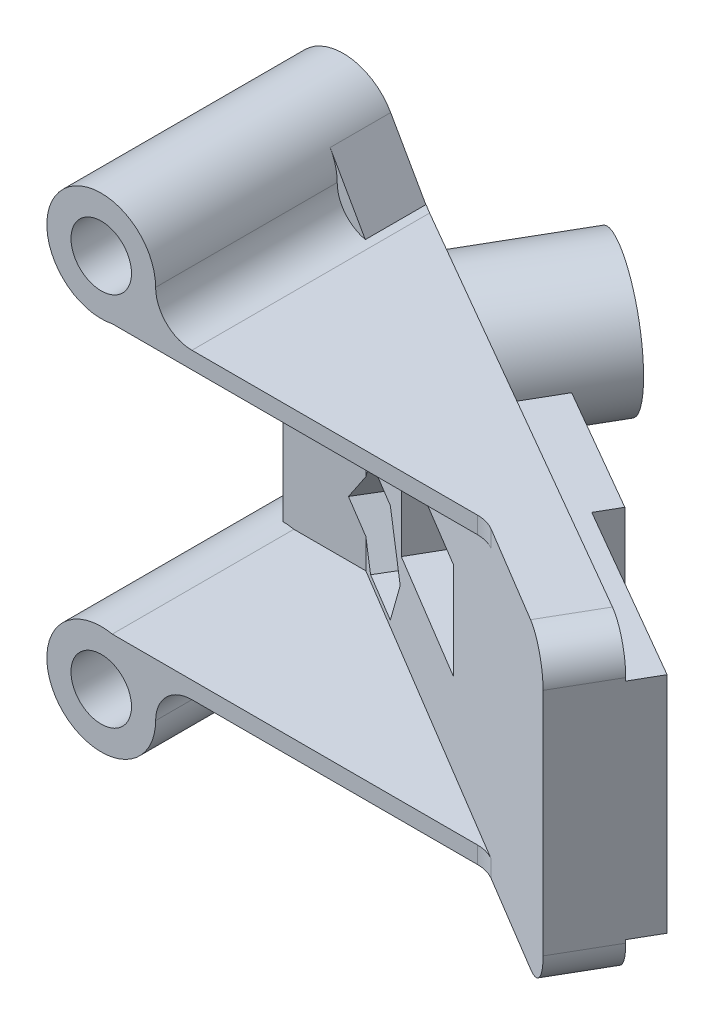
from build123d import *
from build123d.topology import SkipClean

# Parameters (mm, degrees)
CROQUIS3_R                 = 2.5
SALIENTE_EXTRUIR1_DEPTH    = 5
CROQUIS6_W                 = 27
CROQUIS6_H                 = 16.5
CORTAR_EXTRUIR1_DEPTH      = 2
CROQUIS7_W                 = 29
CROQUIS7_H                 = 18.5
CROQUIS7_W_2               = 27
CROQUIS7_H_2               = 16.5
SALIENTE_EXTRUIR2_DEPTH    = 2.5
CROQUIS8_W                 = 12
CROQUIS8_H                 = 18.5
SALIENTE_EXTRUIR3_DEPTH    = 2
CROQUIS9_W                 = 12.5
CROQUIS9_H                 = 8
CORTAR_EXTRUIR2_DEPTH      = 10
CROQUIS10_R                = 3.25
CORTAR_EXTRUIR3_DEPTH      = 10
CORTAR_EXTRUIR4_DEPTH      = 3
CORTAR_EXTRUIR4_DEPTH_BACK = 3
CROQUIS12_R                = 4.493807468
CROQUIS12_R_2              = 2.5
SALIENTE_EXTRUIR4_DEPTH    = 15
SALIENTE_EXTRUIR5_DEPTH    = 1.4
REDONDEO1_R                = 3
SALIENTE_EXTRUIR6_START    = 10
CROQUIS14_R                = 5.706356105
CROQUIS14_R_2              = 3.25
SALIENTE_EXTRUIR6_DEPTH    = 10
CORTAR_EXTRUIR5_DEPTH      = 10


with BuildPart() as part:
    # Croquis3 → Saliente-Extruir1 (new body)
    with BuildSketch(Plane.XY):
        with BuildLine():
            Line((-8.662935846, -3.067476434), (-11.613388129, -8.280831326))
            ThreePointArc((-11.613388129, -8.280831326), (-19.406371569, -8.331091381), (-15.524316735, -1.57366826))
            Line((-15.524316735, -1.57366826), (-15.524316735, 20.438715392))
            ThreePointArc((-15.524316735, 20.438715392), (-19.406371569, 27.196138513), (-11.613388129, 27.145878458))
            Line((-11.613388129, 27.145878458), (-8.662935846, 21.932523566))
            Line((-8.662935846, 21.932523566), (-8.662935846, -3.067476434))
        make_face()
        with Locations((-15.524316735, 24.93252286)):
            Circle(CROQUIS3_R, mode=Mode.SUBTRACT)
        with Locations((-15.524316735, -6.067475728)):
            Circle(CROQUIS3_R, mode=Mode.SUBTRACT)
    extrude(amount=SALIENTE_EXTRUIR1_DEPTH)

    # Croquis5 → section 0 of recubrir1
    with BuildSketch(Plane(origin=(32.473941286, 0, 18.748838743), x_dir=(0.5000000000000042, 0, -0.8660254037844363), z_dir=(0.8660254037844363, 0, 0.5000000000000042)), mode=Mode.PRIVATE) as recubrir1_s0:
        with BuildLine():
            Line((-4.331467923, 21.932523566), (-9.331467923, 21.932523566))
            Line((-9.331467923, 21.932523566), (-9.331467923, -3.067476434))
            Line((-9.331467923, -3.067476434), (-4.331467923, -3.067476434))
            Line((-4.331467923, -3.067476434), (-4.331467923, 21.932523566))
        make_face()
    # loft up to a face of the part (recubrir1)
    loft([recubrir1_s0.sketch, part.faces().sort_by_distance((-8.662935846, 9.432523566, 2.5))[0]])

    # Croquis6 → Cortar-Extruir1 (cut)
    with BuildSketch(Plane(origin=(-2.165733961, 0, 3.751161257), x_dir=(-0.8660254037844364, 0, -0.5000000000000041), z_dir=(0.500000000000004, 0, -0.8660254037844363))):
        with Locations((-22.997677486, 9.432523566)):
            Rectangle(CROQUIS6_W, CROQUIS6_H)
    extrude(amount=-CORTAR_EXTRUIR1_DEPTH, mode=Mode.SUBTRACT)

    # Croquis7 → Saliente-Extruir2 (add)
    with BuildSketch(Plane(origin=(-2.165733961, 0, 3.751161257), x_dir=(-0.8660254037844364, 0, -0.5000000000000041), z_dir=(0.500000000000004, 0, -0.8660254037844363))):
        with Locations((-22.997677486, 9.432523566)):
            Rectangle(CROQUIS7_W, CROQUIS7_H)
        with Locations((-22.997677486, 9.432523566)):
            Rectangle(CROQUIS7_W_2, CROQUIS7_H_2, mode=Mode.SUBTRACT)
    extrude(amount=SALIENTE_EXTRUIR2_DEPTH)

    # Croquis8 → Saliente-Extruir3 (add)
    with BuildSketch(Plane(origin=(-0.915733961, 0, 1.586097747), x_dir=(-0.8660254037844364, 0, -0.500000000000004), z_dir=(0.500000000000004, 0, -0.8660254037844365))):
        with Locations((-14.497677486, 9.432523566)):
            Rectangle(CROQUIS8_W, CROQUIS8_H)
    extrude(amount=SALIENTE_EXTRUIR3_DEPTH)

    # Croquis9 → Cortar-Extruir2 (cut)
    with BuildSketch(Plane(origin=(0.084266039, 0, -0.14595306), x_dir=(-0.8660254037844364, 0, -0.5000000000000041), z_dir=(0.500000000000004, 0, -0.8660254037844363))):
        with Locations((-9.747677486, 9.182523566)):
            Rectangle(CROQUIS9_W, CROQUIS9_H)
    extrude(amount=-CORTAR_EXTRUIR2_DEPTH, mode=Mode.SUBTRACT)

    # Croquis10 → Cortar-Extruir3 (cut)
    with BuildSketch(Plane(origin=(-2.165733961, 0, 3.751161257), x_dir=(-0.8660254037844364, 0, -0.5000000000000041), z_dir=(0.500000000000004, 0, -0.8660254037844363))):
        with Locations((1.502322514, 15.932523566)):
            Circle(CROQUIS10_R)
        with Locations((1.502322514, 2.932523566)):
            Circle(CROQUIS10_R)
    extrude(amount=-CORTAR_EXTRUIR3_DEPTH, mode=Mode.SUBTRACT)

    # Croquis11 → Cortar-Extruir4 (cut, two sides: drawn at the far end of the back side and taken through both)
    with BuildSketch(Plane(origin=(-4.488412426, 0, 7.498698109), x_dir=(0.8580379698740155, 0, 0.5135862559049632), z_dir=(-0.5135862559049631, 0, 0.8580379698740154)).offset(-CORTAR_EXTRUIR4_DEPTH_BACK)):
        Polygon((-6.099034085, 15.932523566), (-3.731897982, 11.832523566), (1.002374226, 11.832523566), (3.369510329, 15.932523566), (1.002374226, 20.032523566), (-3.731897982, 20.032523566), align=None)
        Polygon((-3.731897982, -1.167476434), (-6.099034085, 2.932523566), (-3.731897982, 7.032523566), (1.002374226, 7.032523566), (3.369510329, 2.932523566), (1.002374226, -1.167476434), align=None)
    extrude(amount=CORTAR_EXTRUIR4_DEPTH + CORTAR_EXTRUIR4_DEPTH_BACK, mode=Mode.SUBTRACT)

    # Croquis12 → Saliente-Extruir4 (add)
    # profile 1 of 2: a face of its own
    with SkipClean():  # the faces are left unmerged after this step: merging them gives an invalid solid
        with BuildSketch(Plane.XY.offset(5)):
            with Locations(Location((-15.524316735, -6.067475728, 0), (0, 0, 90))):
                Circle(CROQUIS12_R)
            with Locations((-15.524316735, -6.067475728)):
                Circle(CROQUIS12_R_2, mode=Mode.SUBTRACT)
        # profile 2 of 2: a face of its own
        with BuildSketch(Plane.XY.offset(5)):
            with Locations(Location((-15.524316735, 24.93252286, 0), (0, 0, 270))):
                Circle(CROQUIS12_R)
            with Locations((-15.524316735, 24.93252286)):
                Circle(CROQUIS12_R_2, mode=Mode.SUBTRACT)
        extrude(amount=SALIENTE_EXTRUIR4_DEPTH)

    # Croquis13 → Saliente-Extruir5 (add)
    with SkipClean():  # the faces are left unmerged after this step: merging them gives an invalid solid
        with BuildSketch(Plane(origin=(0, 21.932523566, 0), x_dir=(1, 0, 0), z_dir=(0, 1, 0))):
            Polygon((-8.662935846, -5), (16.397254921, -20), (-16.030509266, -20), (-16.030509266, -5), align=None)
        saliente_extruir5 = extrude(amount=-SALIENTE_EXTRUIR5_DEPTH)

    # Simetría1: Saliente-Extruir5 across plane
    with SkipClean():  # the faces are left unmerged after this step: merging them gives an invalid solid
        add(saliente_extruir5.mirror(Plane(origin=(0, 9.432523566, 0), x_dir=(0, 0, 1), z_dir=(0, -1, 0))))

    # Redondeo1
    # the kernel refuses this fillet: 3 mm, written as the material it adds along each edge
    with BuildSketch(Plane(origin=(16.397254921, 21.932523566, 20), x_dir=(0.8580379698740132, 0, 0.5135862559049668), z_dir=(0, -1, 0))) as redondeo1_piece_1:
        with BuildLine():
            CenterArc((REDONDEO1_R * 0.2764132188, REDONDEO1_R), REDONDEO1_R, 239.0969949, 30.9030051)
            Line((-REDONDEO1_R * 0.237173037105, REDONDEO1_R * 0.141962030126), (0, 0))
            Line((0, 0), (REDONDEO1_R * 0.2764132188, 0))
        make_face()
    extrude(amount=1.4)
    with BuildSketch(Plane(origin=(-12.178526873, 21.932523566, 20), x_dir=(0.357397896635504, 0.9339522169150398, 0), z_dir=(0, 0, -1))) as redondeo1_piece_2_section:
        with BuildLine():
            CenterArc((4.284349419, 2.80185655), REDONDEO1_R, 159.059522314, 89.999994603)
            Line((1.482492768, 3.87405024), (0, 0))
            ThreePointArc((0, 0), (1.606077732, 0.296806172), (3.212155465, 0))
        make_face()
    redondeo1_piece_2 = extrude(amount=25.370044017, mode=Mode.PRIVATE)
    redondeo1_piece_2 = split(redondeo1_piece_2, bisect_by=Plane(origin=(-10.732886495, 22.627434276, 0), z_dir=(0, 0, 1)), keep=Keep.TOP, mode=Mode.PRIVATE)
    redondeo1_piece_2 = split(redondeo1_piece_2, bisect_by=Plane(origin=(-4.802740059, 22.627434276, 2.228685076), z_dir=(-0.5000000000000042, 0, 0.8660254037844363)), keep=Keep.TOP, mode=Mode.PRIVATE)
    add(redondeo1_piece_2)
    with BuildSketch(Plane(origin=(16.397254921, -3.067476434, 20), x_dir=(0.8580379698740109, 0, 0.5135862559049705), z_dir=(0, 1, 0))) as redondeo1_piece_3:
        with BuildLine():
            CenterArc((REDONDEO1_R * 0.2764132188, -REDONDEO1_R), REDONDEO1_R, 90, 30.9030051)
            Line((-REDONDEO1_R * 0.237173037105, -REDONDEO1_R * 0.141962030126), (0, 0))
            Line((0, 0), (REDONDEO1_R * 0.2764132188, 0))
        make_face()
    extrude(amount=1.4)
    with BuildSketch(Plane(origin=(-12.178526873, -3.067476434, 20), x_dir=(1, 0, 0), z_dir=(0, 0, -1))) as redondeo1_piece_4_section:
        with BuildLine():
            CenterArc((4.148017607, 3), REDONDEO1_R, 180.000005397, 89.999994603)
            ThreePointArc((1.148017607, 2.999999717), (0.851211586, 1.393921957), (0, 0))
            Line((0, 0), (4.148017607, 0))
        make_face()
    redondeo1_piece_4 = extrude(amount=25.370044017, mode=Mode.PRIVATE)
    redondeo1_piece_4 = split(redondeo1_piece_4, bisect_by=Plane(origin=(-8.521402606, -3.090294966, 0), z_dir=(0, 0, 1)), keep=Keep.TOP, mode=Mode.PRIVATE)
    redondeo1_piece_4 = split(redondeo1_piece_4, bisect_by=Plane(origin=(-3.144127143, -3.090294966, 3.18628569), z_dir=(-0.5000000000000042, 0, 0.8660254037844363)), keep=Keep.TOP, mode=Mode.PRIVATE)
    add(redondeo1_piece_4)
    # the kernel refuses this fillet: 3 mm, written as the material it takes off along each edge
    with BuildSketch(Plane(origin=(34.058207325, 21.932523566, 16.004809472), x_dir=(0, -1, 0), z_dir=(-0.5000000000000042, 0, 0.8660254037844363))) as redondeo1_2_piece_1:
        with BuildLine():
            CenterArc((REDONDEO1_R, -REDONDEO1_R), REDONDEO1_R, 90, 90)
            Line((0, -REDONDEO1_R), (0, 0))
            Line((0, 0), (REDONDEO1_R, 0))
        make_face()
    extrude(amount=20, mode=Mode.SUBTRACT)
    with BuildSketch(Plane(origin=(24.058207325, -3.067476434, 33.325317547), x_dir=(-0.8660254037844363, 0, -0.5000000000000041), z_dir=(0.5000000000000042, 0, -0.8660254037844363))) as redondeo1_2_piece_2:
        with BuildLine():
            CenterArc((REDONDEO1_R, REDONDEO1_R), REDONDEO1_R, 180, 90)
            Line((0, REDONDEO1_R), (0, 0))
            Line((0, 0), (REDONDEO1_R, 0))
        make_face()
    extrude(amount=20, mode=Mode.SUBTRACT)

    # Croquis14 → Saliente-Extruir6 (add)
    with BuildSketch(Plane(origin=(-2.165733961, 0, 3.751161257), x_dir=(-0.8660254037844363, 0, -0.5000000000000042), z_dir=(0.5000000000000041, 0, -0.8660254037844362)).offset(SALIENTE_EXTRUIR6_START)):
        with Locations(Location((1.502322514, 15.932523566, 0), (0, 0, 208.810793743))):
            Circle(CROQUIS14_R)
        with Locations((1.502322514, 15.932523566)):
            Circle(CROQUIS14_R_2, mode=Mode.SUBTRACT)
    extrude(amount=-SALIENTE_EXTRUIR6_DEPTH)

    # Croquis15 → Cortar-Extruir5 (cut)
    with BuildSketch(Plane(origin=(-2.947653659, 0, 4.9245842), x_dir=(0.8580379698740153, 0, 0.5135862559049633), z_dir=(-0.5135862559049633, 0, 0.8580379698740153))):
        Polygon((3.369510329, 15.932523566), (1.002374226, 20.032523566), (-3.731897982, 20.032523566), (-6.099034085, 15.932523566), (-3.731897982, 11.832523566), (1.002374226, 11.832523566), align=None)
    extrude(amount=-CORTAR_EXTRUIR5_DEPTH, mode=Mode.SUBTRACT)


solid = part.part
